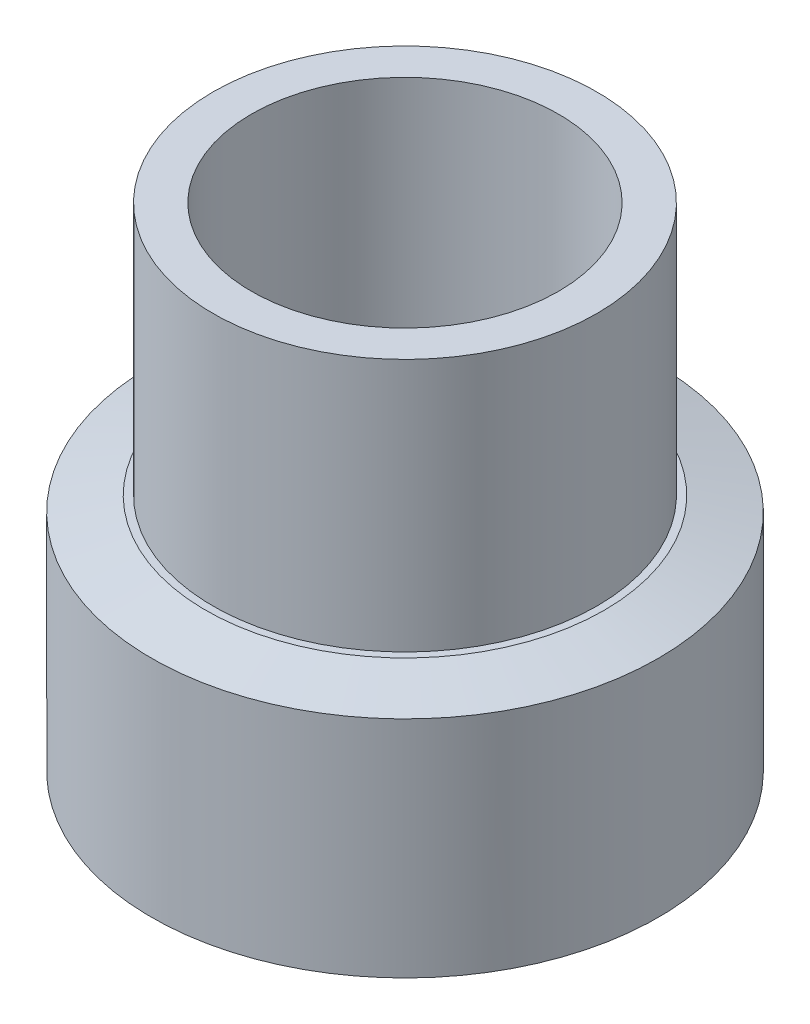
from build123d import *

# Parameters (mm, degrees)
CHAMFER_2_SIZE           = 0.705
CHAMFER_2_SIZE2          = 0.188904181
CHAMFER_3_SIZE           = 0.705
CHAMFER_3_SIZE2          = 0.188904181
CUT_EXTRUDE_2_DEPTH      = 9.083316151
CUT_EXTRUDE_2_DEPTH_BACK = 9.083316151
SKETCH_4_R               = 2


with BuildPart() as part:
    # Эскиз2 → Повернуть2 (revolve)
    with BuildSketch(Plane.XY):
        Polygon((0, 0), (3.3, 0), (3.3, 3.3), (2.5, 3.3), (2.5, 6.6), (0, 6.6), align=None)
    revolve(axis=Axis((0, 6.6, 0), (0, -1, 0)))

    # Фаска2
    chamfer_2_edges = [part.edges().sort_by_distance(p)[0] for p in [
        (-3.3, 3.3, 0),
    ]]
    chamfer_2_side = [part.faces().sort_by_distance(p)[0] for p in [
        (-3.206661905, 3.3, 0),
    ]]
    chamfer(chamfer_2_edges, length=CHAMFER_2_SIZE, length2=CHAMFER_2_SIZE2, reference=chamfer_2_side[0])

    # Фаска3
    chamfer_3_edges = [part.edges().sort_by_distance(p)[0] for p in [
        (-3.3, 0, 0),
    ]]
    chamfer_3_side = [part.faces().sort_by_distance(p)[0] for p in [
        (0, 0, 0),
    ]]
    chamfer(chamfer_3_edges, length=CHAMFER_3_SIZE, length2=CHAMFER_3_SIZE2, reference=chamfer_3_side[0])

    # Эскиз4 → Вырез-Вытянуть2 (cut, two sides: drawn at the far end of the back side and taken through both)
    with BuildSketch(Plane(origin=(0, 6.6, 0), x_dir=(1, 0, 0), z_dir=(0, 1, 0)).offset(-CUT_EXTRUDE_2_DEPTH_BACK)):
        Circle(SKETCH_4_R)
    extrude(amount=CUT_EXTRUDE_2_DEPTH + CUT_EXTRUDE_2_DEPTH_BACK, mode=Mode.SUBTRACT)


solid = part.part
